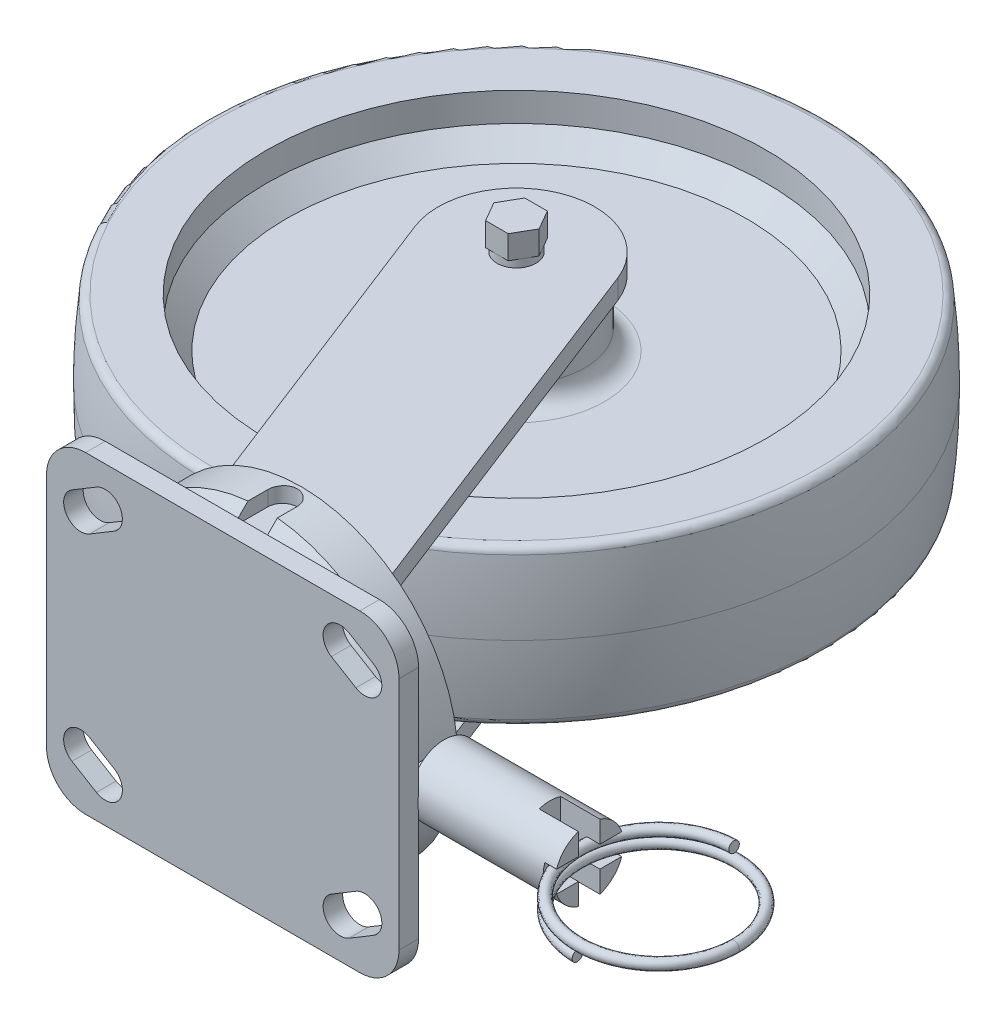
from build123d import *
from build123d.topology import SkipClean

# Parameters (mm, degrees)
FILLET4_R               = 2.54
CHAMFER1_SIZE           = 1.524
EXTRUDE1_DEPTH          = 6.35
SKETCH7_W               = 114.3
SKETCH7_H               = 6.35
EXTRUDE2_DEPTH          = 50.8
EXTRUDE8_DEPTH          = 6.35
EXTRUDE10_DEPTH         = 3.175
EXTRUDE3_DEPTH          = 11.176
CHAMFER2_SIZE           = 5.08
EXTRUDE4_DEPTH          = 11.43
CHAMFER3_SIZE           = 5.08
CUT_EXTRUDE1_DEPTH      = 6.35
FILLET1_R               = 12.7
CUT_EXTRUDE2_DEPTH      = 176.484970088
CUT_EXTRUDE2_DEPTH_BACK = 176.484970088
SKETCH11_R              = 6.35
SKETCH12_R              = 6.3246
EXTRUDE5_DEPTH          = 39.8145
EXTRUDE6_DEPTH          = 7.62
CUT_EXTRUDE7_DEPTH      = 5.08
CIRPATTERN3_COUNT       = 4
SKETCH34_W              = 6.985
SKETCH34_H              = 22.225
CUT_EXTRUDE8_DEPTH      = 12.7
SKETCH35_W              = 22.225
SKETCH35_H              = 6.985
CUT_EXTRUDE9_DEPTH      = 3.81
SWEEP1_PITCH            = 3.4544
SWEEP2_PITCH            = 3.4544


with BuildPart() as part:
    # Sketch1 → Revolve1 (revolve)
    with BuildSketch(Plane.XY, mode=Mode.PRIVATE) as revolve1_sk:
        with BuildLine():
            Line((0, 0), (0, -30.1625))
            Line((0, -30.1625), (22.225, -30.1625))
            Line((22.225, -30.1625), (22.225, -15.875))
            ThreePointArc((22.225, -15.875), (24.084871939, -11.384871939), (28.575, -9.525))
            Line((28.575, -9.525), (74.450359697, -9.525))
            Line((74.450359697, -9.525), (81.026, -16.100640303))
            Line((81.026, -16.100640303), (81.026, -25.4))
            Line((81.026, -25.4), (100.076, -25.4))
            ThreePointArc((100.076, -25.4), (101.218657716, -12.722839463), (101.6, 0))
            Line((101.6, 0), (0, 0))
        make_face()
    revolve(revolve1_sk.sketch.rotate(Axis((0, 22.225, 0), (0, -1, 0)), 180), axis=Axis((0, 22.225, 0), (0, -1, 0)))

    # Fillet4
    fillet4_edges = [part.edges().sort_by_distance(p)[0] for p in [
        (100.076, -25.4, 0),
    ]]
    fillet(fillet4_edges, radius=FILLET4_R)

    # Chamfer1
    chamfer1_edges = [part.edges().sort_by_distance(p)[0] for p in [
        (22.225, -30.1625, 0),
    ]]
    chamfer(chamfer1_edges, length=CHAMFER1_SIZE)


with BuildPart() as body_2:
    # Sketch3 → Extrude1 (new body)
    with BuildSketch(Plane.XZ.offset(30.9245)):
        with BuildLine():
            Line((-23.672918657, 9.206135033), (17.196917719, 114.3))
            Line((17.196917719, 114.3), (71.703082281, 114.3))
            Line((71.703082281, 114.3), (23.672918657, -9.206135033))
            ThreePointArc((23.672918657, -9.206135033), (-9.206135033, -23.672918657), (-23.672918657, 9.206135033))
        make_face()
    extrude(amount=EXTRUDE1_DEPTH)

    # Sketch20 → Extrude8 (add)
    with BuildSketch(Plane.XY.offset(114.3)):
        with BuildLine():
            Line((-6.35, 0), (95.25, 0))
            ThreePointArc((95.25, 0), (44.45, -50.8), (-6.35, 0))
        make_face()
    extrude(amount=EXTRUDE8_DEPTH)

    # Sketch24 → Extrude10 (add)
    with BuildSketch(Plane(origin=(0, 0, 114.3), x_dir=(-1, 0, 0), z_dir=(0, 0, -1))):
        with BuildLine():
            Line((-69.85, 0), (-19.05, 0))
            ThreePointArc((-19.05, 0), (-44.45, -25.4), (-69.85, 0))
        make_face()
    extrude(amount=EXTRUDE10_DEPTH)

    # Sketch8 → Extrude3 (add)
    with BuildSketch(Plane.XY.offset(120.65)):
        with BuildLine():
            Line((-6.35, 0), (12.7, 0))
            ThreePointArc((12.7, 0), (44.45, -31.75), (76.2, 0))
            Line((76.2, 0), (95.25, 0))
            ThreePointArc((95.25, 0), (44.45, -50.8), (-6.35, 0))
        make_face()
    extrude(amount=EXTRUDE3_DEPTH)

    # Chamfer2
    chamfer2_edges = [body_2.edges().sort_by_distance(p)[0] for p in [
        (44.45, -50.8, 131.826),
    ]]
    chamfer(chamfer2_edges, length=CHAMFER2_SIZE)


with BuildPart() as body_3:
    # Sketch7 → Extrude2 (new body)
    with BuildSketch(Plane(origin=(0, 0, 0), x_dir=(1, 0, 0), z_dir=(0, 1, 0))):
        with Locations((44.45, -136.525)):
            Rectangle(SKETCH7_W, SKETCH7_H)
    extrude(amount=-EXTRUDE2_DEPTH)

    # Sketch9 → Extrude4 (add)
    with BuildSketch(Plane(origin=(0, 0, 133.35), x_dir=(-1, 0, 0), z_dir=(0, 0, -1))):
        with BuildLine():
            Line((-69.85, 0), (-50.8, 0))
            ThreePointArc((-50.8, 0), (-44.45, -6.35), (-38.1, 0))
            Line((-38.1, 0), (-19.05, 0))
            ThreePointArc((-19.05, 0), (-44.45, -25.4), (-69.85, 0))
        make_face()
    extrude(amount=EXTRUDE4_DEPTH)

    # Chamfer3
    chamfer3_edges = [body_3.edges().sort_by_distance(p)[0] for p in [
        (44.45, -6.35, 133.35),
    ]]
    chamfer(chamfer3_edges, length=CHAMFER3_SIZE)

    # Sketch10 → Cut-Extrude1 (cut)
    with BuildSketch(Plane.XY.offset(139.7)):
        with BuildLine():
            Line((1.271167041, -28.573054932), (9.208667041, -33.335554932))
            ThreePointArc((9.208667041, -33.335554932), (11.114445068, -40.958667041), (3.491332959, -42.864445068))
            Line((3.491332959, -42.864445068), (-4.446167041, -38.101945068))
            ThreePointArc((-4.446167041, -38.101945068), (-6.351945068, -30.478832959), (1.271167041, -28.573054932))
        make_face()
        with BuildLine():
            Line((85.408667041, -42.864445068), (93.346167041, -38.101945068))
            ThreePointArc((93.346167041, -38.101945068), (95.251945068, -30.478832959), (87.628832959, -28.573054932))
            Line((87.628832959, -28.573054932), (79.691332959, -33.335554932))
            ThreePointArc((79.691332959, -33.335554932), (77.785554932, -40.958667041), (85.408667041, -42.864445068))
        make_face()
    extrude(amount=-CUT_EXTRUDE1_DEPTH, mode=Mode.SUBTRACT)

    # Fillet1
    fillet1_edges = [body_3.edges().sort_by_distance(p)[0] for p in [
        (101.6, -50.8, 136.525),
        (-12.7, -50.8, 136.525),
    ]]
    fillet(fillet1_edges, radius=FILLET1_R)

    # Mirror1: body 3 across plane


with BuildPart() as cut_extrude2_tool:
    # Sketch11 → Cut-Extrude2 (new, two sides: drawn at the far end of the back side and taken through both)
    with BuildSketch(Plane(origin=(0, -30.9245, 0), x_dir=(-1, 0, 0), z_dir=(0, 1, 0)).offset(-CUT_EXTRUDE2_DEPTH_BACK)):
        with Locations(Location((0, 0, 0), (0, 0, 180))):
            Circle(SKETCH11_R)
    extrude(amount=CUT_EXTRUDE2_DEPTH + CUT_EXTRUDE2_DEPTH_BACK)


with BuildPart() as part_1:
    add(part.part)

    # Cut-Extrude2: cut by cut_extrude2_tool
    add(cut_extrude2_tool.part, mode=Mode.SUBTRACT)

    # Mirror1 2: part across plane


with BuildPart() as body_2_1:
    add(body_2.part)

    # Cut-Extrude2: cut by cut_extrude2_tool
    add(cut_extrude2_tool.part, mode=Mode.SUBTRACT)

    # Mirror1 3: body 2 across plane


with BuildPart() as body_4:
    # Sketch12 → Extrude5 (new body)
    with BuildSketch(Plane(origin=(0, 0, 0), x_dir=(-1, 0, 0), z_dir=(0, 1, 0))):
        with Locations(Location((0, 0, 0), (0, 0, 90))):
            Circle(SKETCH12_R)
    extrude(amount=-EXTRUDE5_DEPTH)

    # Sketch13 → Extrude6 (add)
    with BuildSketch(Plane.XZ.offset(39.8145)):
        Polygon((3.666174209, 6.35), (-3.666174209, 6.35), (-7.332348419, 0), (-3.666174209, -6.35), (3.666174209, -6.35), (7.332348419, 0), align=None)
    extrude(amount=EXTRUDE6_DEPTH)

    # Mirror1 4: body 4 across plane


with BuildPart() as body_3_1:
    add(body_3.part)
    add(body_3.part.mirror(Plane.ZX))

    # Sketch33 → Revolve2 (revolve)
    with BuildSketch(Plane(origin=(0, 0, 0), x_dir=(1, 0, 0), z_dir=(0, 1, 0)), mode=Mode.PRIVATE) as revolve2_sk:
        Polygon((92.71, -117.7925), (99.06, -117.7925), (99.06, -111.379), (146.05, -111.379), (146.05, -122.4915), (92.71, -122.4915), align=None)
    revolve(revolve2_sk.sketch.rotate(Axis((92.71, 0, 122.4915), (1, 0, 0)), 180), axis=Axis((92.71, 0, 122.4915), (1, 0, 0)))

    # Sketch34 → Cut-Extrude8 (cut)
    with BuildSketch(Plane(origin=(146.05, 0, 0), x_dir=(0, 0, -1), z_dir=(1, 0, 0))):
        with Locations((-122.4915, 0)):
            Rectangle(SKETCH34_W, SKETCH34_H)
    extrude(amount=-CUT_EXTRUDE8_DEPTH, mode=Mode.SUBTRACT)

    # Sketch35 → Cut-Extrude9 (cut)
    with BuildSketch(Plane(origin=(146.05, 0, 0), x_dir=(0, 0, -1), z_dir=(1, 0, 0))):
        with Locations((-122.4915, 0)):
            Rectangle(SKETCH35_W, SKETCH35_H)
    extrude(amount=-CUT_EXTRUDE9_DEPTH, mode=Mode.SUBTRACT)



with BuildPart() as part_2:
    add(part_1.part)
    add(part_1.part.mirror(Plane.ZX))


with BuildPart() as body_2_2:
    with SkipClean():  # the faces are left unmerged after this step: merging them gives an invalid solid
        add(body_2_1.part)
        add(body_2_1.part.mirror(Plane.ZX))

    # Sketch32 → Cut-Extrude7 (cut)
    with BuildSketch(Plane(origin=(95.25, 0, 0), x_dir=(0, 0, -1), z_dir=(1, 0, 0))):
        with BuildLine():
            Line((-131.826, 4.7625), (-120.3325, 4.7625))
            ThreePointArc((-120.3325, 4.7625), (-115.57, 0), (-120.3325, -4.7625))
            Line((-120.3325, -4.7625), (-131.826, -4.7625))
            Line((-131.826, -4.7625), (-131.826, 4.7625))
        make_face()
    cut_extrude7 = extrude(amount=-CUT_EXTRUDE7_DEPTH, mode=Mode.SUBTRACT)

    # CirPattern3: Cut-Extrude7 ×4 about axis
    cirpattern3_axis = Axis((44.45, 0, 0), (0, 0, 1))
    for i in range(1, CIRPATTERN3_COUNT):
        add(cut_extrude7.rotate(cirpattern3_axis, i * 360 / CIRPATTERN3_COUNT), mode=Mode.SUBTRACT)


with BuildPart() as body_4_1:
    add(body_4.part)
    add(body_4.part.mirror(Plane.ZX))


with BuildPart() as body_5:
    # Sweep1: the profile of Sketch38 screwed along a left-hand helix of 0.75 turns, 8 arcs to a turn; built about Z, then put on its axis
    sweep1_z = Axis((0, 0, 0), (0, 0, 1))
    sweep1_corners = [(27.1145, 0, 0), (25.4, 0.037101786, 1.714098512), (23.6855, 0, 0), (25.4, -0.037101786, -1.714098512)]
    with BuildLine(mode=Mode.PRIVATE) as sweep1_profile:
        ThreePointArc((27.1145, 0, 0), (26.612334576, 0.026234925, 1.212050681), (25.4, 0.037101786, 1.714098512))
        ThreePointArc((25.4, 0.037101786, 1.714098512), (24.187665424, 0.026234925, 1.212050681), (23.6855, 0, 0))
        ThreePointArc((23.6855, 0, 0), (24.187665424, -0.026234925, -1.212050681), (25.4, -0.037101786, -1.714098512))
        ThreePointArc((25.4, -0.037101786, -1.714098512), (26.612334576, -0.026234925, -1.212050681), (27.1145, 0, 0))
    sweep1_cap = Face(sweep1_profile.wire())
    sweep1_arcs = [((27.1145, 0, 0), (27.1145, 0.037101786, 1.714098512), (25.4, 0.037101786, 1.714098512), (1, 0.7071067811865476, 1)), ((25.4, 0.037101786, 1.714098512), (23.6855, 0.037101786, 1.714098512), (23.6855, 0, 0), (1, 0.7071067811865476, 1)), ((23.6855, 0, 0), (23.6855, -0.037101786, -1.714098512), (25.4, -0.037101786, -1.714098512), (1, 0.7071067811865476, 1)), ((25.4, -0.037101786, -1.714098512), (27.1145, -0.037101786, -1.714098512), (27.1145, 0, 0), (1, 0.7071067811865476, 1))]  # start, shoulder, end, weights
    sweep1_turn_angles = [0, -22.5, -45, -67.5, -90, -112.5, -135, -157.5, -180, -202.5, -225, -247.5, -270]
    sweep1_turn_weights = [1, 0.9238795325112867, 1, 0.9238795325112867, 1, 0.9238795325112867, 1, 0.9238795325112867, 1, 0.9238795325112867, 1, 0.9238795325112854, 1]
    sweep1_turn_sides = [Face.make_bezier_surface([[Vector(p[j][0], p[j][1], 0).rotate(sweep1_z, sweep1_turn_angles[2 * i + k]) / sweep1_turn_weights[2 * i + k] + Vector(0, 0, p[j][2] + -SWEEP1_PITCH * sweep1_turn_angles[2 * i + k] / 360) for k in range(3)] for j in range(3)], [[p[3][j] * sweep1_turn_weights[2 * i + k] for k in range(3)] for j in range(3)]) for p in sweep1_arcs for i in range(6)]
    sweep1 = Plane(origin=(167.64, 0, 122.4915), x_dir=(1, 0, 0), z_dir=(0, 1, 0)) * Solid(Shell([*sweep1_turn_sides, sweep1_cap, sweep1_cap.rotate(sweep1_z, -270).moved(Location((0, 0, -SWEEP1_PITCH * -270 / 360)))]))
    add(sweep1)


with BuildPart() as body_3_2:
    add(body_3_1.part)

    add(body_5.part)  # Sweep2 merges body 5
    # Sweep2: the profile of Sketch40 screwed along a left-hand helix of 0.75 turns, 8 arcs to a turn; built about Z, then put on its axis
    sweep2_z = Axis((0, 0, 0), (0, 0, 1))
    sweep2_corners = [(27.1145, 0, 0), (25.4, -0.037101786, -1.714098512), (23.6855, 0, 0), (25.4, 0.037101786, 1.714098512)]
    with BuildLine(mode=Mode.PRIVATE) as sweep2_profile:
        ThreePointArc((27.1145, 0, 0), (26.612334576, -0.026234925, -1.212050681), (25.4, -0.037101786, -1.714098512))
        ThreePointArc((25.4, -0.037101786, -1.714098512), (24.187665424, -0.026234925, -1.212050681), (23.6855, 0, 0))
        ThreePointArc((23.6855, 0, 0), (24.187665424, 0.026234925, 1.212050681), (25.4, 0.037101786, 1.714098512))
        ThreePointArc((25.4, 0.037101786, 1.714098512), (26.612334576, 0.026234925, 1.212050681), (27.1145, 0, 0))
    sweep2_cap = Face(sweep2_profile.wire())
    sweep2_arcs = [((27.1145, 0, 0), (27.1145, -0.037101786, -1.714098512), (25.4, -0.037101786, -1.714098512), (1, 0.7071067811865476, 1)), ((25.4, -0.037101786, -1.714098512), (23.6855, -0.037101786, -1.714098512), (23.6855, 0, 0), (1, 0.7071067811865476, 1)), ((23.6855, 0, 0), (23.6855, 0.037101786, 1.714098512), (25.4, 0.037101786, 1.714098512), (1, 0.7071067811865476, 1)), ((25.4, 0.037101786, 1.714098512), (27.1145, 0.037101786, 1.714098512), (27.1145, 0, 0), (1, 0.7071067811865476, 1))]  # start, shoulder, end, weights
    sweep2_turn_angles = [0, -22.5, -45, -67.5, -90, -112.5, -135, -157.5, -180, -202.5, -225, -247.5, -270]
    sweep2_turn_weights = [1, 0.9238795325112867, 1, 0.9238795325112867, 1, 0.9238795325112867, 1, 0.9238795325112867, 1, 0.9238795325112867, 1, 0.9238795325112849, 1]
    sweep2_turn_sides = [Face.make_bezier_surface([[Vector(p[j][0], p[j][1], 0).rotate(sweep2_z, sweep2_turn_angles[2 * i + k]) / sweep2_turn_weights[2 * i + k] + Vector(0, 0, p[j][2] + -SWEEP2_PITCH * sweep2_turn_angles[2 * i + k] / 360) for k in range(3)] for j in range(3)], [[p[3][j] * sweep2_turn_weights[2 * i + k] for k in range(3)] for j in range(3)]) for p in sweep2_arcs for i in range(6)]
    sweep2 = Plane(origin=(167.64, 0, 122.4915), x_dir=(1, 0, 0), z_dir=(0, -1, 0)) * Solid(Shell([*sweep2_turn_sides, sweep2_cap, sweep2_cap.rotate(sweep2_z, -270).moved(Location((0, 0, -SWEEP2_PITCH * -270 / 360)))]))
    add(sweep2)


solid = Compound([part_2.part, body_2_2.part, body_4_1.part, body_3_2.part])
